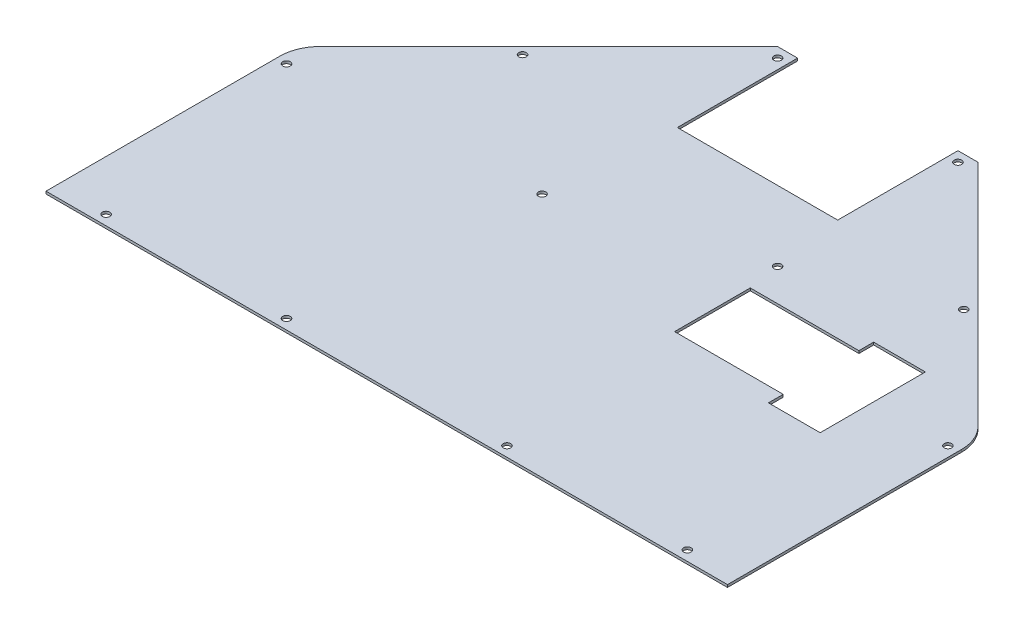
from build123d import *

# Parameters (mm, degrees)
EXTRUDE1_DEPTH     = 1.5875
MIRROR1_DEPTH      = 1.5875
CUT_EXTRUDE1_REACH = 534.229
SKETCH3_R          = 2.38125
CUT_EXTRUDE2_DEPTH = 533.229351555
FILLET1_R          = 25.4


# Read off the part's stored shape, not the designer's step: Mirror1
with BuildPart() as part:
    # Sketch1 → Extrude1 (new body)
    with BuildSketch(Plane(origin=(0, 0, 0), x_dir=(1, 0, 0), z_dir=(0, 1, 0))):
        Polygon((0, 0), (0, 158.75), (152.4, 311.15), (165.1, 311.15), (165.1, 234.95), (215.9, 234.95), (215.9, 0), align=None)
    extrude(amount=EXTRUDE1_DEPTH)

    # Mirror1 outline → Mirror1 (add)
    with BuildSketch(Plane(origin=(0, 0, 0), x_dir=(1, 0, 0), z_dir=(0, 1, 0))):
        Polygon((215.9, 0), (431.8, 0), (431.8, 158.75), (279.4, 311.15), (266.7, 311.15), (266.7, 234.95), (215.9, 234.95), align=None)
    extrude(amount=MIRROR1_DEPTH)

    # Sketch2 → Cut-Extrude1 (cut, up to next)
    with BuildSketch(Plane(origin=(0, 1.5875, 0), x_dir=(-1, 0, 0), z_dir=(0, 1, 0)), mode=Mode.PRIVATE) as cut_extrude1_sk1:
        Polygon((-276.225, -170.020724332), (-345.059, -170.020724332), (-345.059, -179.3875), (-377.825, -179.3875), (-377.825, -112.7125), (-345.059, -112.7125), (-345.059, -122.079275668), (-276.225, -122.079275668), align=None)
    cut_extrude1_tool1 = extrude(cut_extrude1_sk1.sketch, amount=-CUT_EXTRUDE1_REACH, mode=Mode.PRIVATE) & part.part
    add(cut_extrude1_tool1.solids().sort_by_distance((330.876817, 1.5875, -146.05))[0], mode=Mode.SUBTRACT)

    # Sketch3 → Cut-Extrude2 (cut, through all)
    with BuildSketch(Plane.XZ):
        with Locations(Location((400.05, -6.35, 0), (0, 0, 270))):
            Circle(SKETCH3_R)
        with Locations(Location((425.45, -146.05, 0), (0, 0, 270))):
            Circle(SKETCH3_R)
        with Locations(Location((355.710774635, -225.858969244, 0), (0, 0, 270))):
            Circle(SKETCH3_R)
        with Locations(Location((273.05, -304.8, 0), (0, 0, 270))):
            Circle(SKETCH3_R)
        with Locations(Location((273.05, -190.5, 0), (0, 0, 270))):
            Circle(SKETCH3_R)
        with Locations(Location((285.75, -6.35, 0), (0, 0, 270))):
            Circle(SKETCH3_R)
        with Locations(Location((158.75, -304.8, 0), (0, 0, 270))):
            Circle(SKETCH3_R)
        with Locations(Location((158.75, -155.575, 0), (0, 0, 270))):
            Circle(SKETCH3_R)
        with Locations(Location((146.05, -6.35, 0), (0, 0, 270))):
            Circle(SKETCH3_R)
        with Locations(Location((31.75, -6.35, 0), (0, 0, 270))):
            Circle(SKETCH3_R)
        with Locations(Location((6.35, -146.05, 0), (0, 0, 270))):
            Circle(SKETCH3_R)
        with Locations(Location((76.089225365, -225.858969244, 0), (0, 0, 270))):
            Circle(SKETCH3_R)
    extrude(amount=-CUT_EXTRUDE2_DEPTH, mode=Mode.SUBTRACT)

    # Fillet1
    fillet1_edges = [part.edges().sort_by_distance(p)[0] for p in [
        (0, 0.79375, -158.75),
        (431.8, 0.79375, -158.75),
    ]]
    fillet(fillet1_edges, radius=FILLET1_R)


solid = part.part
